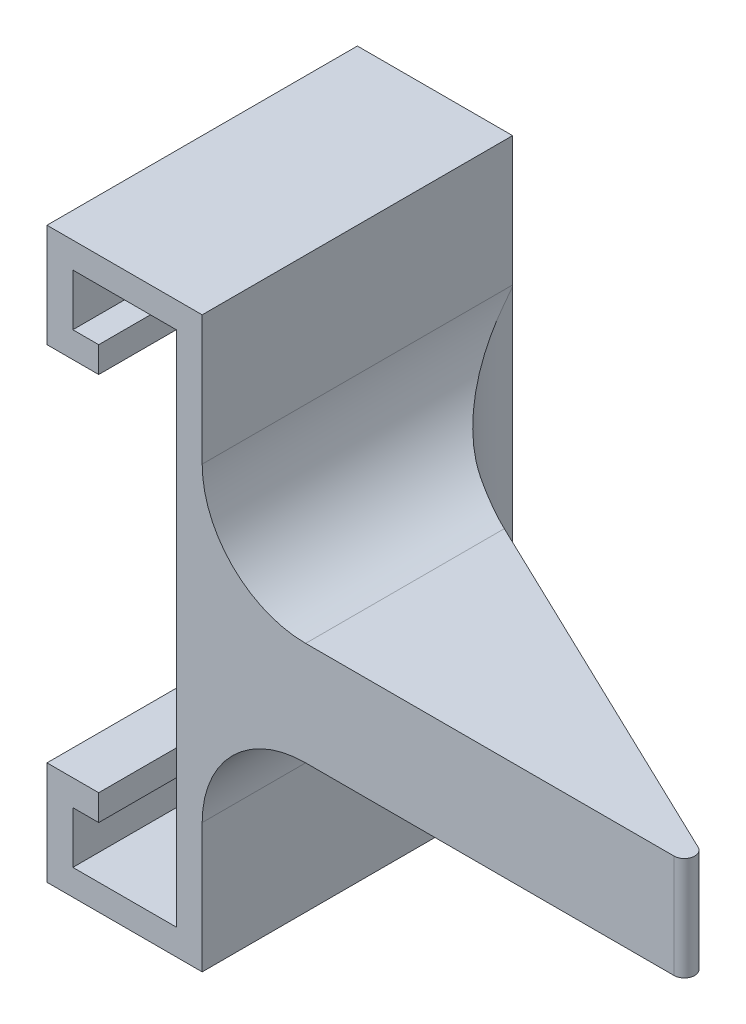
from build123d import *

# Parameters (mm, degrees)
BOSS_EXTRUDE1_DEPTH      = 30
BOSS_EXTRUDE2_DEPTH      = 5
BOSS_EXTRUDE2_DEPTH_BACK = 5
FILLET1_R                = 10
FILLET2_R                = 1


with BuildPart() as part:
    # Sketch2 → Boss-Extrude1 (new body)
    with BuildSketch(Plane.XY):
        Polygon((0, 0), (-5, 0), (-5, 10), (10, 10), (10, -45), (-5, -45), (-5, -35), (0, -35), (0, -37.5), (-2.5, -37.5), (-2.5, -42.5), (7.5, -42.5), (7.5, 7.5), (-2.5, 7.5), (-2.5, 2.5), (0, 2.5), align=None)
    extrude(amount=BOSS_EXTRUDE1_DEPTH)

    # Sketch3 → Boss-Extrude2 (add, two sides: drawn at the far end of the back side and taken through both)
    with BuildSketch(Plane(origin=(0, -17.5, 0), x_dir=(-1, 0, 0), z_dir=(0, -1, 0)).offset(-BOSS_EXTRUDE2_DEPTH_BACK)):
        Polygon((-10, -6), (-60, -30), (-10, -30), align=None)
    extrude(amount=BOSS_EXTRUDE2_DEPTH + BOSS_EXTRUDE2_DEPTH_BACK)

    # Fillet1
    # the kernel refuses this fillet: 10 mm, written as the material it adds along each edge
    with BuildSketch(Plane(origin=(10, -22.5, 6), x_dir=(0, 0, -1), z_dir=(0, 1, 0))) as fillet1_piece_1:
        with BuildLine():
            CenterArc((6.294420553, -9.995664887), FILLET1_R, 91.687149317, 62.671844859)
            Line((-2.720810021, -5.668354211), (0, 0))
            Line((0, 0), (6, 0))
        make_face()
    extrude(amount=10)
    with BuildSketch(Plane(origin=(10, -12.5, 30), x_dir=(0, 1, 0), z_dir=(0, 0, -1))) as fillet1_piece_2_section:
        with BuildLine():
            CenterArc((FILLET1_R, FILLET1_R), FILLET1_R, 180, 90)
            Line((0, FILLET1_R), (0, 0))
            Line((0, 0), (FILLET1_R, 0))
        make_face()
    fillet1_piece_2 = extrude(amount=49, mode=Mode.PRIVATE)
    fillet1_piece_2 = split(fillet1_piece_2, bisect_by=Plane(origin=(19.362808843, -12.5, 10.494148244), z_dir=(-0.4327310675847713, 0, 0.9015230574682737)), keep=Keep.TOP, mode=Mode.PRIVATE)
    add(fillet1_piece_2)
    with BuildSketch(Plane(origin=(10, -22.5, 30), x_dir=(0, -1, 0), z_dir=(0, 0, -1))) as fillet1_piece_3_section:
        with BuildLine():
            CenterArc((FILLET1_R, -FILLET1_R), FILLET1_R, 90, 90)
            Line((0, -FILLET1_R), (0, 0))
            Line((0, 0), (FILLET1_R, 0))
        make_face()
    fillet1_piece_3 = extrude(amount=49, mode=Mode.PRIVATE)
    fillet1_piece_3 = split(fillet1_piece_3, bisect_by=Plane(origin=(19.362808843, -22.5, 10.494148244), z_dir=(-0.4327310675847713, 0, 0.9015230574682737)), keep=Keep.TOP, mode=Mode.PRIVATE)
    add(fillet1_piece_3)
    with BuildSketch(Plane(origin=(10, -22.5, 30), x_dir=(0, -1, 0), z_dir=(0, 0, -1))) as fillet1_piece_4a_section:
        with BuildLine():
            CenterArc((FILLET1_R, -FILLET1_R), FILLET1_R, 90, 90)
            Line((0, -FILLET1_R), (0, 0))
            Line((0, 0), (FILLET1_R, 0))
        make_face()
    fillet1_piece_4a = extrude(amount=49, mode=Mode.PRIVATE)
    fillet1_piece_4a = split(fillet1_piece_4a, bisect_by=Plane(origin=(10, -22.5, 0), z_dir=(0, 0, 1)), keep=Keep.TOP, mode=Mode.PRIVATE)
    fillet1_piece_4a = split(fillet1_piece_4a, bisect_by=Plane(origin=(19.362808843, -22.5, 10.494148244), z_dir=(0.4327310675847713, 0, -0.9015230574682737)), keep=Keep.TOP, mode=Mode.PRIVATE)
    with BuildSketch(Plane(origin=(10, -38.218827612, 6), x_dir=(0, 0, -1), z_dir=(0, 1, 0))) as fillet1_piece_4b_section:
        with BuildLine():
            CenterArc((6.294420553, -9.995664887), FILLET1_R, 91.687149317, 62.671844859)
            Line((-2.720810021, -5.668354211), (0, 0))
            Line((0, 0), (6, 0))
        make_face()
    fillet1_piece_4b = extrude(amount=25.718827612, mode=Mode.PRIVATE)
    fillet1_piece_4b = split(fillet1_piece_4b, bisect_by=Plane(origin=(10, -22.5, 6), z_dir=(0, -1, 0)), keep=Keep.TOP, mode=Mode.PRIVATE)
    fillet1_piece_4 = fillet1_piece_4a & fillet1_piece_4b
    add(fillet1_piece_4)
    with BuildSketch(Plane(origin=(10, -22.5, 6), x_dir=(0, 0, -1), z_dir=(0, 1, 0))) as fillet1_piece_5a_section:
        with BuildLine():
            CenterArc((6.294420553, -9.995664887), FILLET1_R, 91.687149317, 62.671844859)
            Line((-2.720810021, -5.668354211), (0, 0))
            Line((0, 0), (6, 0))
        make_face()
    fillet1_piece_5a = extrude(amount=25.718827612, mode=Mode.PRIVATE)
    fillet1_piece_5a = split(fillet1_piece_5a, bisect_by=Plane(origin=(10, -12.5, 6), z_dir=(0, 1, 0)), keep=Keep.TOP, mode=Mode.PRIVATE)
    with BuildSketch(Plane(origin=(10, -12.5, 30), x_dir=(0, 1, 0), z_dir=(0, 0, -1))) as fillet1_piece_5b_section:
        with BuildLine():
            CenterArc((FILLET1_R, FILLET1_R), FILLET1_R, 180, 90)
            Line((0, FILLET1_R), (0, 0))
            Line((0, 0), (FILLET1_R, 0))
        make_face()
    fillet1_piece_5b = extrude(amount=49, mode=Mode.PRIVATE)
    fillet1_piece_5b = split(fillet1_piece_5b, bisect_by=Plane(origin=(10, -12.5, 0), z_dir=(0, 0, 1)), keep=Keep.TOP, mode=Mode.PRIVATE)
    fillet1_piece_5b = split(fillet1_piece_5b, bisect_by=Plane(origin=(19.362808843, -12.5, 10.494148244), z_dir=(0.4327310675847713, 0, -0.9015230574682737)), keep=Keep.TOP, mode=Mode.PRIVATE)
    fillet1_piece_5 = fillet1_piece_5a & fillet1_piece_5b
    add(fillet1_piece_5)

    # Fillet2
    fillet2_edges = [part.edges().sort_by_distance(p)[0] for p in [
        (60, -17.5, 30),
    ]]
    fillet(fillet2_edges, radius=FILLET2_R)


solid = part.part
